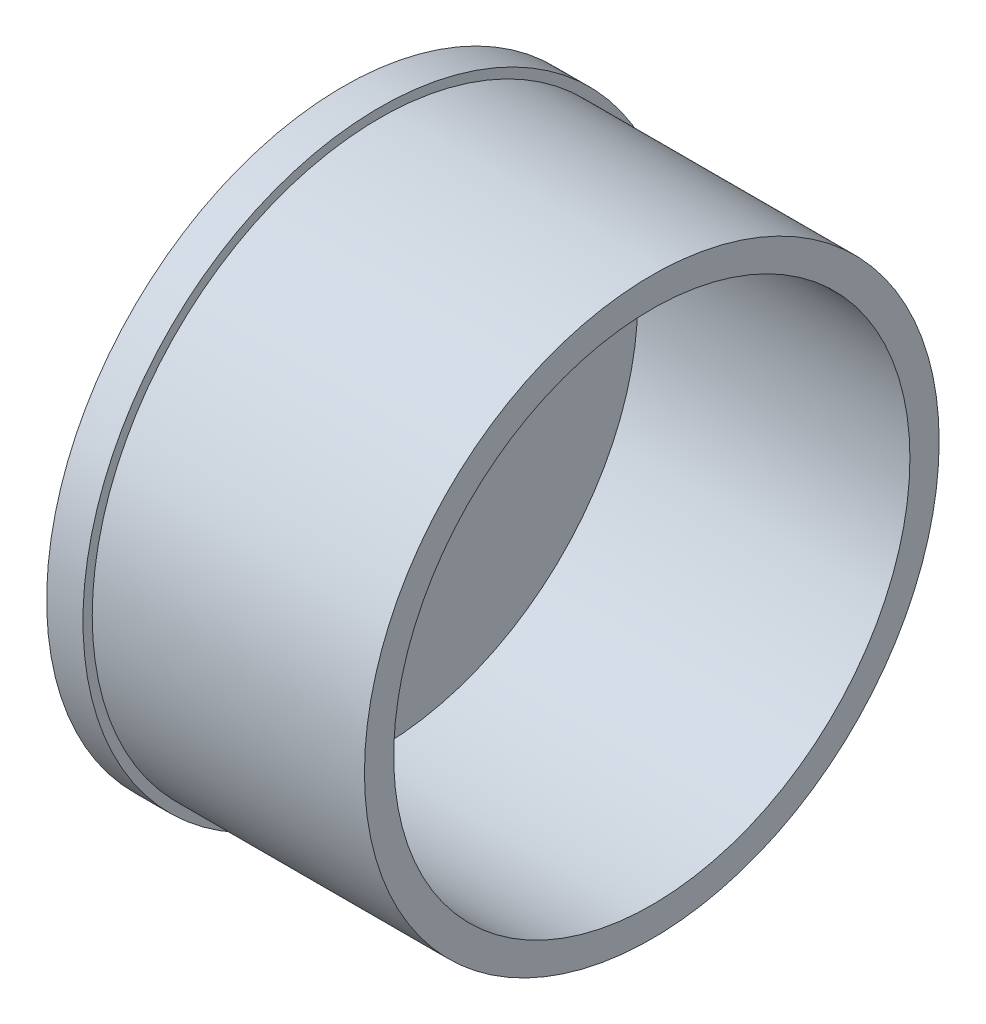
from build123d import *


with BuildPart() as part:
    # Sketch1 → Revolve1 (revolve)
    with BuildSketch(Plane(origin=(0, 0, 0), x_dir=(0, 1, 0), z_dir=(0, 0, 1))):
        Polygon((49.03, 6), (10, 6), (10, 0), (42.668831169, 0), (42.668831169, -45), (47.5, -45), (47.5, 0), (49.03, 0), align=None)
    revolve(axis=Axis((0, 0, 0), (-1, 0, 0)))


solid = part.part
